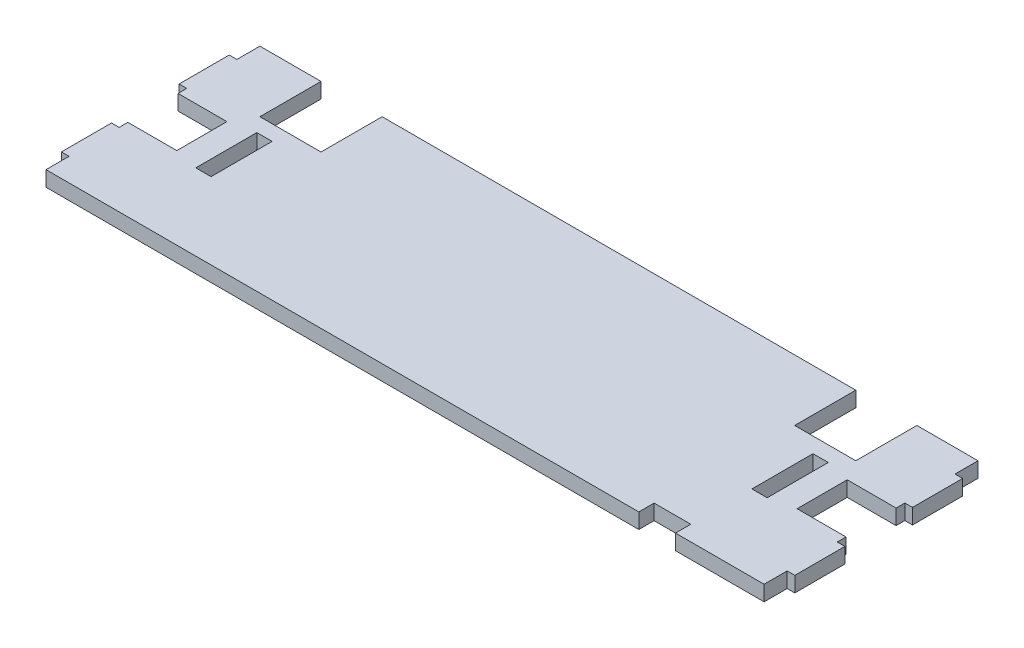
from build123d import *

# Parameters (mm, degrees)
BOSS_EXTRUDE1_DEPTH     = 3.175
CUT_EXTRUDE1_DEPTH      = 159.781746826
CUT_EXTRUDE1_DEPTH_BACK = 159.781746826
SKETCH2_W               = 6.35
SKETCH2_H               = 25.4


with BuildPart() as part:
    # Sketch1 → Boss-Extrude1 (new, symmetric)
    with BuildSketch(Plane(origin=(0, 0, 0), x_dir=(1, 0, 0), z_dir=(0, 1, 0))):
        Polygon((149.225, -44.45), (112.395, -44.45), (112.395, -38.1), (97.155, -38.1), (97.155, -44.45), (-149.225, -44.45), (-149.225, -34.874677354), (-152.4, -34.874677354), (-152.4, -14.046677354), (-149.225, -14.046677354), (-149.225, -10.414), (-128.905, -10.414), (-128.905, 10.414), (-149.225, 10.414), (-149.225, 14.046677354), (-152.4, 14.046677354), (-152.4, 34.874677354), (-149.225, 34.874677354), (-149.225, 44.45), (-123.825, 44.45), (-123.825, 19.05), (-98.425, 19.05), (-98.425, 44.45), (98.425, 44.45), (98.425, 19.05), (123.825, 19.05), (123.825, 44.45), (149.225, 44.45), (149.225, 34.874677354), (152.4, 34.874677354), (152.4, 14.046677354), (149.225, 14.046677354), (149.225, 10.414), (128.905, 10.414), (128.905, -10.414), (149.225, -10.414), (149.225, -14.046677354), (152.4, -14.046677354), (152.4, -34.874677354), (149.225, -34.874677354), align=None)
    extrude(amount=BOSS_EXTRUDE1_DEPTH, both=True)

    # Sketch2 → Cut-Extrude1 (cut, two sides: drawn at the far end of the back side and taken through both)
    with BuildSketch(Plane(origin=(0, 0, 0), x_dir=(1, 0, 0), z_dir=(0, 1, 0)).offset(-CUT_EXTRUDE1_DEPTH_BACK)):
        with Locations((115.57, 0)):
            Rectangle(SKETCH2_W, SKETCH2_H)
        with Locations((-115.57, 0)):
            Rectangle(SKETCH2_W, SKETCH2_H)
    extrude(amount=CUT_EXTRUDE1_DEPTH + CUT_EXTRUDE1_DEPTH_BACK, mode=Mode.SUBTRACT)


solid = part.part
